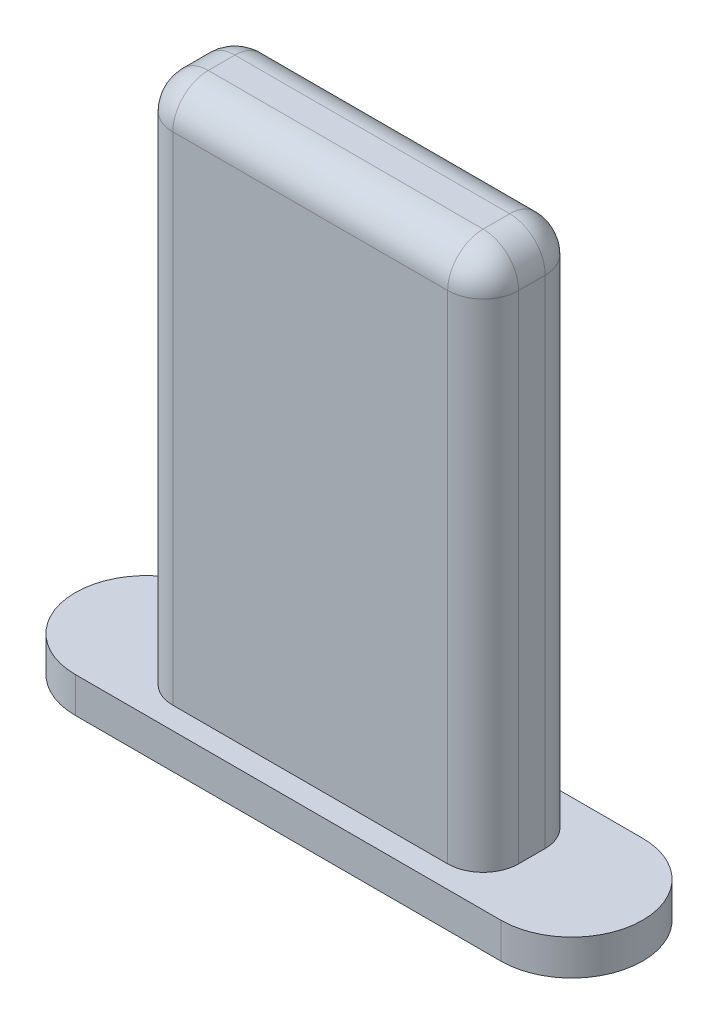
from build123d import *

# Parameters (mm, degrees)
BOSS_EXTRUDE1_DEPTH = 1
SKETCH2_W           = 9.75
SKETCH2_H           = 2.75
BOSS_EXTRUDE2_DEPTH = 15
FILLET1_R           = 1
FILLET2_R           = 1


with BuildPart() as part:
    # Sketch1 → Boss-Extrude1 (new body)
    with BuildSketch(Plane(origin=(0, 0, 0), x_dir=(1, 0, 0), z_dir=(0, 1, 0))):
        with BuildLine():
            Line((6, -2), (-6, -2))
            ThreePointArc((-6, -2), (-8, 0), (-6, 2))
            Line((-6, 2), (6, 2))
            ThreePointArc((6, 2), (8, 0), (6, -2))
        make_face()
    extrude(amount=BOSS_EXTRUDE1_DEPTH)

    # Sketch2 → Boss-Extrude2 (add)
    with BuildSketch(Plane(origin=(0, 1, 0), x_dir=(1, 0, 0), z_dir=(0, 1, 0))):
        Rectangle(SKETCH2_W, SKETCH2_H)
    extrude(amount=BOSS_EXTRUDE2_DEPTH)

    # Fillet1
    fillet1_edges = [part.edges().sort_by_distance(p)[0] for p in [
        (-4.875, 16, 0),
        (0, 16, 1.375),
        (4.875, 16, 0),
        (0, 16, -1.375),
    ]]
    fillet(fillet1_edges, radius=FILLET1_R)

    # Fillet2
    # the kernel refuses this fillet: 1 mm, written as the material it takes off along each edge
    with BuildSketch(Plane(origin=(3.875, 15, 0.375), x_dir=(1, 0, 0), z_dir=(0, 0, 1))) as fillet2_piece_1_section:
        Polygon((0, 0), (FILLET2_R * 1.02, 0), (FILLET2_R * 1.02, FILLET2_R * 1.02), (0, FILLET2_R * 1.02), align=None)
    fillet2_piece_1 = extrude(amount=FILLET2_R * 1.02, mode=Mode.PRIVATE)
    fillet2_piece_1 = fillet2_piece_1 - Plane(origin=(3.875, 15, 0.375), x_dir=(-0.7071067811865475, -0.7071067811865475, 0), z_dir=(0, 0, 1)) * Sphere(FILLET2_R, mode=Mode.PRIVATE)
    add(fillet2_piece_1, mode=Mode.SUBTRACT)
    with BuildSketch(Plane(origin=(-3.875, 15, 0.375), x_dir=(-1, 0, 0), z_dir=(0, 0, 1))) as fillet2_piece_2_section:
        Polygon((0, 0), (FILLET2_R * 1.02, 0), (FILLET2_R * 1.02, -FILLET2_R * 1.02), (0, -FILLET2_R * 1.02), align=None)
    fillet2_piece_2 = extrude(amount=FILLET2_R * 1.02, mode=Mode.PRIVATE)
    fillet2_piece_2 = fillet2_piece_2 - Plane(origin=(-3.875, 15, 0.375), x_dir=(0.7071067811865475, -0.7071067811865475, 0), z_dir=(0, 0, 1)) * Sphere(FILLET2_R, mode=Mode.PRIVATE)
    add(fillet2_piece_2, mode=Mode.SUBTRACT)
    with BuildSketch(Plane(origin=(3.875, 15, -0.375), x_dir=(0, 0, -1), z_dir=(1, 0, 0))) as fillet2_piece_3_section:
        Polygon((0, 0), (FILLET2_R * 1.02, 0), (FILLET2_R * 1.02, FILLET2_R * 1.02), (0, FILLET2_R * 1.02), align=None)
    fillet2_piece_3 = extrude(amount=FILLET2_R * 1.02, mode=Mode.PRIVATE)
    fillet2_piece_3 = fillet2_piece_3 - Plane(origin=(3.875, 15, -0.375), x_dir=(0, -0.7071067811865475, 0.7071067811865475), z_dir=(1, 0, 0)) * Sphere(FILLET2_R, mode=Mode.PRIVATE)
    add(fillet2_piece_3, mode=Mode.SUBTRACT)
    with BuildSketch(Plane(origin=(-3.875, 15, -0.375), x_dir=(0, 0, -1), z_dir=(-1, 0, 0))) as fillet2_piece_4_section:
        Polygon((0, 0), (FILLET2_R * 1.02, 0), (FILLET2_R * 1.02, -FILLET2_R * 1.02), (0, -FILLET2_R * 1.02), align=None)
    fillet2_piece_4 = extrude(amount=FILLET2_R * 1.02, mode=Mode.PRIVATE)
    fillet2_piece_4 = fillet2_piece_4 - Plane(origin=(-3.875, 15, -0.375), x_dir=(0, -0.7071067811865475, 0.7071067811865475), z_dir=(-1, 0, 0)) * Sphere(FILLET2_R, mode=Mode.PRIVATE)
    add(fillet2_piece_4, mode=Mode.SUBTRACT)
    with BuildSketch(Plane(origin=(-4.875, 1, -1.375), x_dir=(0, 0, 1), z_dir=(0, 1, 0)), Plane(origin=(-4.875, 1, 1.375), x_dir=(1, 0, 0), z_dir=(0, 1, 0))) as fillet2_piece_5:
        with BuildLine():
            CenterArc((FILLET2_R, FILLET2_R), FILLET2_R, 180, 90)
            Line((0, FILLET2_R), (0, 0))
            Line((0, 0), (FILLET2_R, 0))
        make_face()
    extrude(amount=14, mode=Mode.SUBTRACT)
    with BuildSketch(Plane(origin=(4.875, 1, -1.375), x_dir=(0, 0, 1), z_dir=(0, 1, 0)), Plane(origin=(4.875, 1, 1.375), x_dir=(-1, 0, 0), z_dir=(0, 1, 0))) as fillet2_piece_6:
        with BuildLine():
            CenterArc((FILLET2_R, -FILLET2_R), FILLET2_R, 90, 90)
            Line((0, -FILLET2_R), (0, 0))
            Line((0, 0), (FILLET2_R, 0))
        make_face()
    extrude(amount=14, mode=Mode.SUBTRACT)


solid = part.part
